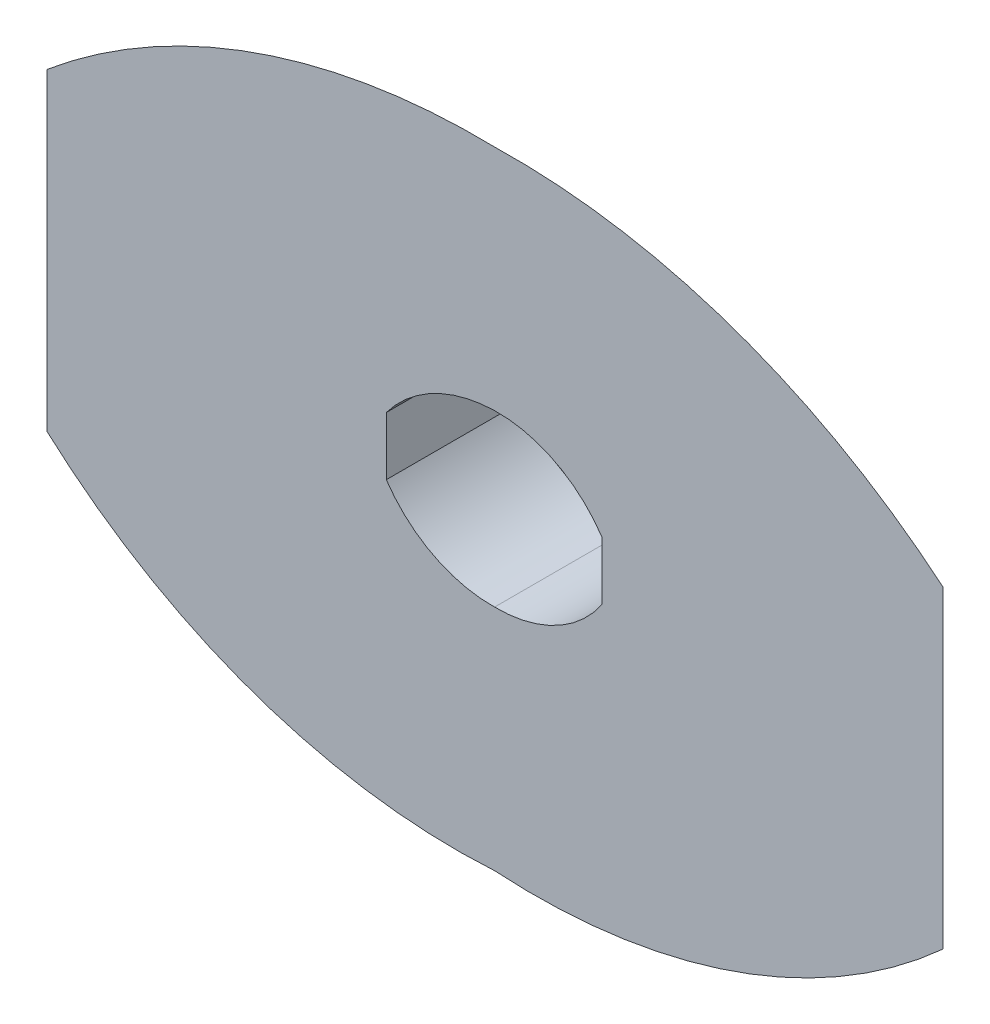
from build123d import *

# Parameters (mm, degrees)
BOSS_EXTRUDE1_DEPTH = 30
CUT_EXTRUDE1_DEPTH  = 30


with BuildPart() as part:
    # Sketch1 → Boss-Extrude1 (new body)
    with BuildSketch(Plane.XY):
        with BuildLine():
            Line((48, -6.5), (48, 6.5))
            ThreePointArc((48, 6.5), (37.602709859, 15.827202928), (24, 19))
            ThreePointArc((24, 19), (10.468468753, 15.563590687), (-0.188408081, 6.544598337))
            Line((-0.188408081, 6.544598337), (-0.188408081, -6.455401663))
            ThreePointArc((-0.188408081, -6.455401663), (10.310769364, -15.803220123), (24, -19))
            ThreePointArc((24, -19), (37.575943366, -15.775811264), (48, -6.5))
        make_face()
    extrude(amount=BOSS_EXTRUDE1_DEPTH)

    # Boundary3: read off the stored shape, not the designer's step
    # Boundary3: loft between two sections, ruled curve by curve
    boundary3_from = [
        Edge.make_bspline([(48, 6.5, 0), (46.693896538, 8.456739584, 0), (43.588222449, 12.040695886, 0), (37.739856517, 16.090524514, 0), (31.068980756, 18.561134268, 0), (26.352039165, 19.051456966, 0), (24, 19, 0)], [0, 0, 0, 0, 0.25, 0.5, 0.75, 1, 1, 1, 1], 3),
        Edge.make_bspline([(24, 19, 0), (21.653645041, 18.948667391, 0), (16.972687403, 18.311721244, 0), (10.346073824, 15.801281815, 0), (4.453562487, 11.865214769, 0), (1.216218556, 8.424768713, 0), (-0.188408081, 6.544598337, 0)], [0, 0, 0, 0, 0.25, 0.5, 0.75, 1, 1, 1, 1], 3),
        Edge.make_bspline([(-0.188408081, -6.455401663, 0), (1.137170866, -8.416782752, 0), (4.278977495, -12.007809658, 0), (10.174338056, -16.06628603, 0), (16.887924476, -18.54706494, 0), (21.63314098, -19.046407973, 0), (24, -19, 0)], [0, 0, 0, 0, 0.25, 0.5, 0.75, 1, 1, 1, 1], 3),
        Edge.make_bspline([(24, -19, 0), (26.349184265, -19.032489102, 0), (31.055507038, -18.514535118, 0), (37.710685379, -16.034515927, 0), (43.557763047, -12.002943446, 0), (46.67999094, -8.443527292, 0), (48, -6.5, 0)], [0, 0, 0, 0, 0.25, 0.5, 0.75, 1, 1, 1, 1], 3),
        Edge.make_line((48, -6.5, 0), (48, 6.5, 0)),
        Edge.make_line((-0.188408081, 6.544598337, 0), (-0.188408081, -6.455401663, 0)),
    ]
    boundary3_to = [
        Edge.make_bspline([(124.185565628, 34.937701812, 30), (117.255780953, 40.742906307, 30), (102.346855194, 51.100501773, 30), (77.558985244, 62.373034857, 30), (51.151430185, 69.017546472, 30), (33.037432273, 70.217100876, 30), (24, 70, 30)], [0, 0, 0, 0, 0.25, 0.5, 0.75, 1, 1, 1, 1], 3),
        Edge.make_bspline([(24, 70, 30), (14.980008116, 70.208465144, 30), (-3.097456113, 68.998821472, 30), (-29.451330841, 62.360945259, 30), (-54.192567743, 51.115532402, 30), (-69.078737392, 40.787904216, 30), (-76, 35, 30)], [0, 0, 0, 0, 0.25, 0.5, 0.75, 1, 1, 1, 1], 3),
        Edge.make_bspline([(-76, -35, 30), (-69.273583434, -41.079651781, 30), (-54.606610915, -51.895398982, 30), (-29.830832348, -63.44523528, 30), (-3.260114217, -69.866672826, 30), (14.950390393, -70.55804262, 30), (24, -70, 30)], [0, 0, 0, 0, 0.25, 0.5, 0.75, 1, 1, 1, 1], 3),
        Edge.make_bspline([(24, -70, 30), (33.063463281, -70.587425405, 30), (51.308133618, -69.942893548, 30), (77.936602887, -63.553490812, 30), (102.763772692, -51.998773921, 30), (117.452824487, -41.158332308, 30), (124.185565628, -35.062298188, 30)], [0, 0, 0, 0, 0.25, 0.5, 0.75, 1, 1, 1, 1], 3),
        Edge.make_line((124.185565628, -35.062298188, 30), (124.185565628, 34.937701812, 30)),
        Edge.make_line((-76, 35, 30), (-76, -35, 30)),
    ]
    boundary3 = Solid(Shell([*[Face.make_surface_from_curves(boundary3_from[k], boundary3_to[k]) for k in range(6)], Face(Wire(boundary3_from)), Face(Wire(boundary3_to))]))
    add(boundary3)

    # Sketch4 → Cut-Extrude1 (cut)
    with BuildSketch(Plane.XY):
        with BuildLine():
            Line((48, -6.5), (48, 6.5))
            ThreePointArc((48, 6.5), (37.602709859, 15.827202928), (24, 19))
            ThreePointArc((24, 19), (10.468468753, 15.563590687), (-0.188408081, 6.544598337))
            Line((-0.188408081, 6.544598337), (-0.188408081, -6.455401663))
            ThreePointArc((-0.188408081, -6.455401663), (10.310769364, -15.803220123), (24, -19))
            ThreePointArc((24, -19), (37.575943366, -15.775811264), (48, -6.5))
        make_face()
    extrude(amount=CUT_EXTRUDE1_DEPTH, mode=Mode.SUBTRACT)


solid = part.part
